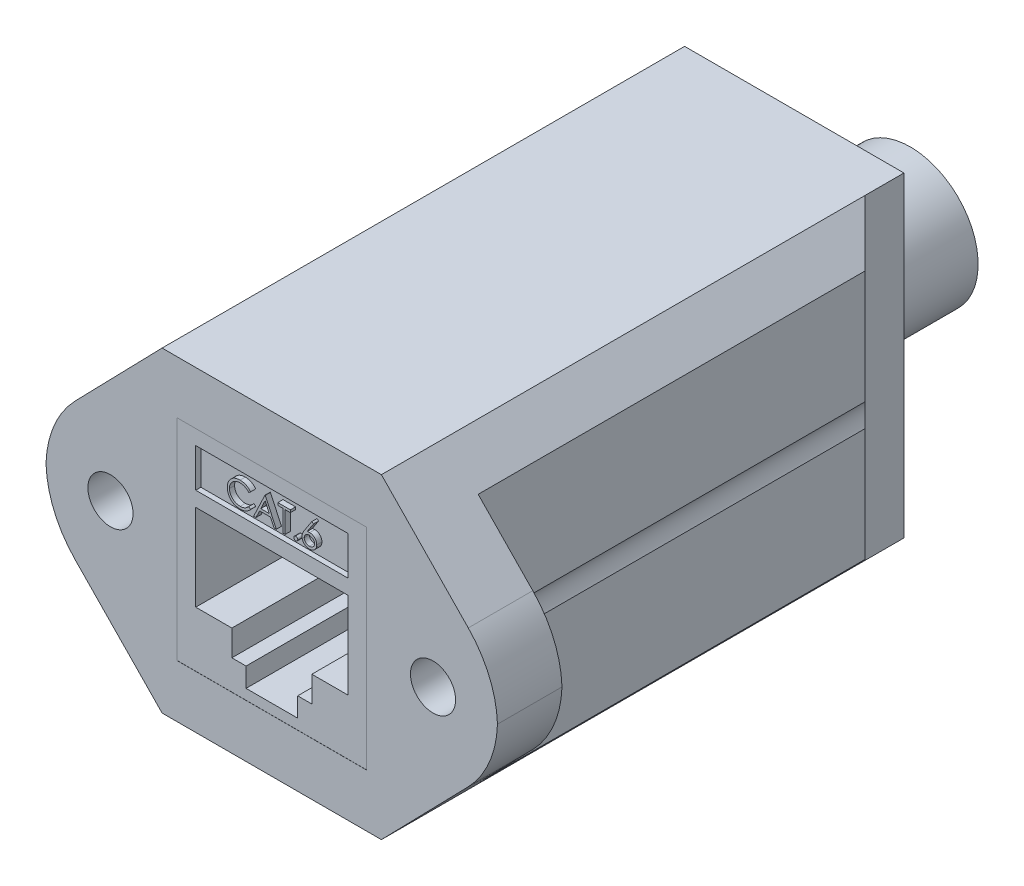
from build123d import *

# Parameters (mm, degrees)
BOSS_EXTRUDE1_DEPTH = 5
FILLET1_R           = 8
BOSS_EXTRUDE2_DEPTH = 30
SKETCH5_W           = 17
SKETCH5_H           = 24.5
BOSS_EXTRUDE3_DEPTH = 5.5
CHAMFER2_SIZE       = 2.5
SKETCH6_R           = 5.25
BOSS_EXTRUDE4_DEPTH = 9
SKETCH7_W           = 14.7
SKETCH7_H           = 16.3
CUT_EXTRUDE1_DEPTH  = 0.01
SKETCH10_R          = 1.75
CUT_EXTRUDE2_DEPTH  = 66.385221365
CUT_EXTRUDE3_DEPTH  = 11
SKETCH12_W          = 11.8
SKETCH12_H          = 3
CUT_EXTRUDE4_DEPTH  = 0.4
BOSS_EXTRUDE5_DEPTH = 0.4


with BuildPart() as part:
    # Sketch2 → Boss-Extrude1 (new body)
    with BuildSketch(Plane.XY):
        Polygon((9, 0), (0, 9.25), (0, 15.25), (9, 24.5), (26, 24.5), (35, 15.25), (35, 9.25), (26, 0), align=None)
    extrude(amount=BOSS_EXTRUDE1_DEPTH)

    # Fillet1
    # the kernel refuses this fillet: 8 mm, written as the material it takes off along each edge
    with BuildSketch(Plane(origin=(35, 9.25, -8.124243331), x_dir=(0, 1, 0), z_dir=(0, 0, 1)), Plane(origin=(35, 15.25, -8.124243331), x_dir=(-0.6973549598034526, 0.7167259309091062, 0), z_dir=(0, 0, 1)), Plane(origin=(0, 9.25, -8.124243331), x_dir=(0.6973549598034534, -0.7167259309091056, 0), z_dir=(0, 0, 1)), Plane(origin=(0, 15.25, -8.124243331), x_dir=(0, -1, 0), z_dir=(0, 0, 1))) as fillet1_piece_1:
        with BuildLine():
            CenterArc((FILLET1_R * 0.406212166571, FILLET1_R), FILLET1_R, 225.784824603, 44.215175397)
            Line((-FILLET1_R * 0.291142793232, FILLET1_R * 0.283274069091), (0, 0))
            Line((0, 0), (FILLET1_R * 0.406212166571, 0))
        make_face()
    extrude(amount=21.248486663, mode=Mode.SUBTRACT)

    # Sketch4 → Boss-Extrude2 (add)
    with BuildSketch(Plane(origin=(0, 0, 0), x_dir=(-1, 0, 0), z_dir=(0, 0, -1))):
        Polygon((-28.5, 21.930555556), (-28.5, 2.569444444), (-26, 0), (-9, 0), (-6.5, 2.569444444), (-6.5, 21.930555556), (-9, 24.5), (-26, 24.5), align=None)
    extrude(amount=BOSS_EXTRUDE2_DEPTH)

    # Sketch5 → Boss-Extrude3 (add)
    with BuildSketch(Plane(origin=(0, 0, -30), x_dir=(-1, 0, 0), z_dir=(0, 0, -1))):
        with Locations((-17.5, 12.25)):
            Rectangle(SKETCH5_W, SKETCH5_H)
    extrude(amount=BOSS_EXTRUDE3_DEPTH)

    # Chamfer2
    # the kernel refuses this chamfer: 2.5 mm, written as the material it adds along each edge
    with BuildSketch(Plane(origin=(9, 0, -30), x_dir=(-0.9996219169112968, 0, 0.027495876610586317), z_dir=(0, 1, 0))) as chamfer2_piece_1_section:
        Polygon((CHAMFER2_SIZE * 0.999621916911, -CHAMFER2_SIZE * 0.0274958766106), (-CHAMFER2_SIZE * 0.0274958766106, -CHAMFER2_SIZE * 0.999621916911), (0, 0), align=None)
    chamfer2_piece_1 = extrude(amount=24.5, mode=Mode.PRIVATE)
    chamfer2_piece_1 = split(chamfer2_piece_1, bisect_by=Plane(origin=(2.494903331, 6.685793799, -30.844793424), z_dir=(0.7167259309091052, 0.6973549598034537, 0)), keep=Keep.TOP, mode=Mode.PRIVATE)
    chamfer2_piece_1 = split(chamfer2_piece_1, bisect_by=Plane(origin=(6.5, 12.25, -30.844793424), z_dir=(1, 0, 0)), keep=Keep.TOP, mode=Mode.PRIVATE)
    chamfer2_piece_1 = split(chamfer2_piece_1, bisect_by=Plane(origin=(2.494903331, 17.814206201, -30.844793424), z_dir=(0.7167259309091052, -0.6973549598034539, 0)), keep=Keep.TOP, mode=Mode.PRIVATE)
    add(chamfer2_piece_1)
    with BuildSketch(Plane(origin=(26, 24.5, -30), x_dir=(-0.027495876610586282, 0, -0.9996219169112968), z_dir=(0, -1, 0))) as chamfer2_piece_2_section:
        Polygon((CHAMFER2_SIZE * 0.999621916911, CHAMFER2_SIZE * 0.0274958766106), (-CHAMFER2_SIZE * 0.0274958766106, CHAMFER2_SIZE * 0.999621916911), (0, 0), align=None)
    chamfer2_piece_2 = extrude(amount=24.5, mode=Mode.PRIVATE)
    chamfer2_piece_2 = split(chamfer2_piece_2, bisect_by=Plane(origin=(32.505096669, 6.685793799, -30.844793424), z_dir=(-0.7167259309091054, 0.6973549598034535, 0)), keep=Keep.TOP, mode=Mode.PRIVATE)
    chamfer2_piece_2 = split(chamfer2_piece_2, bisect_by=Plane(origin=(32.505096669, 17.814206201, -30.844793424), z_dir=(-0.7167259309091054, -0.6973549598034536, 0)), keep=Keep.TOP, mode=Mode.PRIVATE)
    chamfer2_piece_2 = split(chamfer2_piece_2, bisect_by=Plane(origin=(28.5, 12.25, -30.844793424), z_dir=(-1, 0, 0)), keep=Keep.TOP, mode=Mode.PRIVATE)
    add(chamfer2_piece_2)

    # Sketch6 → Boss-Extrude4 (add)
    with BuildSketch(Plane(origin=(0, 0, -35.5), x_dir=(-1, 0, 0), z_dir=(0, 0, -1))):
        with Locations((-17.5, 12.25)):
            Circle(SKETCH6_R)
    extrude(amount=BOSS_EXTRUDE4_DEPTH)

    # Sketch7 → Cut-Extrude1 (cut)
    with BuildSketch(Plane.XY.offset(5)):
        with Locations((17.5, 12.25)):
            Rectangle(SKETCH7_W, SKETCH7_H)
    extrude(amount=-CUT_EXTRUDE1_DEPTH, mode=Mode.SUBTRACT)

    # Sketch10 → Cut-Extrude2 (cut, through all)
    with BuildSketch(Plane.XY.offset(5)):
        with Locations((5, 12.25)):
            Circle(SKETCH10_R)
        with Locations((30, 12.25)):
            Circle(SKETCH10_R)
    extrude(amount=-CUT_EXTRUDE2_DEPTH, mode=Mode.SUBTRACT)

    # Sketch11 → Cut-Extrude3 (cut)
    with BuildSketch(Plane.XY.offset(4.99)):
        Polygon((20.6, 8.4), (23.4, 8.4), (23.4, 15.1), (11.6, 15.1), (11.6, 8.4), (14.4, 8.4), (14.4, 6.4), (15.5, 6.4), (15.5, 4.9), (19.5, 4.9), (19.5, 6.4), (20.6, 6.4), align=None)
    extrude(amount=-CUT_EXTRUDE3_DEPTH, mode=Mode.SUBTRACT)

    # Sketch12 → Cut-Extrude4 (cut)
    with BuildSketch(Plane.XY.offset(4.99)):
        with Locations((17.5, 17.75)):
            Rectangle(SKETCH12_W, SKETCH12_H)
    extrude(amount=-CUT_EXTRUDE4_DEPTH, mode=Mode.SUBTRACT)

    # Sketch13 → Boss-Extrude5 (add)
    # profile 1 of 5: a face of its own
    with BuildSketch(Plane.XY.offset(4.59)):
        with BuildLine():
            Line((15.849746261, 18.262237914), (15.70431023, 18.150934829))
            add(Edge.make_bspline(
                [(15.70431023, 18.150934829), (15.693935447, 18.163299321), (15.673325757, 18.187861606), (15.640168595, 18.222352448), (15.605613142, 18.254666149), (15.569672607, 18.284956644), (15.531700073, 18.312164682), (15.492615401, 18.337708141), (15.451764769, 18.360603986), (15.395275309, 18.388365649), (15.321378323, 18.417335489), (15.228353554, 18.441625949), (15.131245597, 18.457088821), (15.064995201, 18.45876355), (15.031297576, 18.459615385)],
                knots=[0, 0, 0, 0, 0.757959112, 1.505699292, 2.245454638, 2.979532153, 3.711538275, 4.438200793, 5.171680507, 5.909471876, 7.393775596, 8.890124382, 10.418191784, 12, 12, 12, 12], degree=3))
            add(Edge.make_bspline(
                [(15.031297576, 18.459615385), (15.012732664, 18.459401621), (14.975775138, 18.458976078), (14.920927821, 18.453362083), (14.867104665, 18.445471567), (14.814340681, 18.433763584), (14.762703032, 18.418961406), (14.711854136, 18.401273791), (14.662530193, 18.379390189), (14.614048876, 18.355202901), (14.567599043, 18.327883378), (14.52364908, 18.298084229), (14.482359281, 18.266138916), (14.443696982, 18.231927705), (14.407622659, 18.195604668), (14.374397707, 18.156782704), (14.344137094, 18.115585929), (14.316241002, 18.072557584), (14.291257597, 18.027823003), (14.270339702, 17.981216611), (14.251816159, 17.933536523), (14.237158643, 17.884244034), (14.225556919, 17.833685987), (14.217551864, 17.781726695), (14.212001715, 17.728474706), (14.211578288, 17.692380612), (14.21136485, 17.674186615)],
                knots=[0, 0, 0, 0, 1.054917814, 2.100044995, 3.131103042, 4.146048494, 5.169673617, 6.183595914, 7.203665975, 8.234915748, 9.262203917, 10.264457458, 11.251630812, 12.227803204, 13.197192746, 14.159520551, 15.12972552, 16.100847026, 17.073214652, 18.039054194, 19.002613845, 19.979014051, 20.95965708, 21.949030935, 22.966165397, 24, 24, 24, 24], degree=3))
            add(Edge.make_bspline(
                [(14.21136485, 17.674186615), (14.212032563, 17.646812125), (14.213343528, 17.593065945), (14.225010772, 17.514341497), (14.242740549, 17.438924307), (14.269312958, 17.367285807), (14.302078456, 17.298542634), (14.34348078, 17.233857908), (14.391432031, 17.172254142), (14.446610578, 17.115187249), (14.507150322, 17.063057069), (14.572104425, 17.017151553), (14.641311111, 16.978884928), (14.714006244, 16.947041823), (14.790749229, 16.922564305), (14.871402062, 16.905332456), (14.955789327, 16.894091802), (15.013452301, 16.893015642), (15.042798895, 16.892467949)],
                knots=[0, 0, 0, 0, 1.029171465, 2.020641659, 2.987623507, 3.938342917, 4.889210282, 5.84687017, 6.821220943, 7.821438502, 8.827599549, 9.822697543, 10.807740252, 11.797342354, 12.80366471, 13.83203677, 14.896651826, 16, 16, 16, 16], degree=3))
            add(Edge.make_bspline(
                [(15.042798895, 16.892467949), (15.075132401, 16.893361595), (15.138772476, 16.895120504), (15.232100557, 16.91002144), (15.321442816, 16.934182088), (15.40680406, 16.967994738), (15.487943644, 17.01195012), (15.564988543, 17.06523608), (15.638003791, 17.128359489), (15.681909428, 17.176557645), (15.70431023, 17.201148504)],
                knots=[0, 0, 0, 0, 1.028121516, 2.023589091, 2.998037872, 3.967518031, 4.937445131, 5.927275754, 6.942489185, 8, 8, 8, 8], degree=3))
            Line((15.70431023, 17.201148504), (15.849746261, 17.09095845))
            add(Edge.make_bspline(
                [(15.849746261, 17.09095845), (15.838042094, 17.075856853), (15.814689824, 17.045725994), (15.776876623, 17.00324888), (15.737042386, 16.963294662), (15.69489124, 16.926185462), (15.650908075, 16.891178724), (15.604303143, 16.859269005), (15.555689113, 16.830010912), (15.505230702, 16.803220831), (15.452981519, 16.779452121), (15.399004172, 16.759103669), (15.343531326, 16.741575082), (15.286560445, 16.727154265), (15.227973357, 16.715898317), (15.167981481, 16.708373739), (15.106455338, 16.703218642), (15.064946753, 16.702748787), (15.043911926, 16.702510684)],
                knots=[0, 0, 0, 0, 0.986787822, 1.968848986, 2.935600012, 3.899624008, 4.868462664, 5.837806735, 6.815139263, 7.798259679, 8.787526145, 9.778297419, 10.776456485, 11.791383307, 12.812564526, 13.85620153, 14.913611965, 16, 16, 16, 16], degree=3))
            add(Edge.make_bspline(
                [(15.043911926, 16.702510684), (15.023992152, 16.702649321), (14.984603266, 16.70292346), (14.92644851, 16.707364316), (14.86983319, 16.713423135), (14.814919117, 16.722546037), (14.761406622, 16.733311584), (14.709780813, 16.747742624), (14.659533681, 16.763908225), (14.6108671, 16.782907947), (14.563739676, 16.80434776), (14.518303409, 16.828579127), (14.474579197, 16.85539828), (14.432137162, 16.884214056), (14.391604274, 16.915952045), (14.352629283, 16.950171473), (14.314993639, 16.986757003), (14.291708885, 17.01313853), (14.280001753, 17.026402661)],
                knots=[0, 0, 0, 0, 1.114604814, 2.203992996, 3.262667896, 4.300477797, 5.318619304, 6.316056647, 7.298880507, 8.271930387, 9.238335007, 10.195173496, 11.151986948, 12.108099108, 13.064862484, 14.031167946, 15.010108607, 16, 16, 16, 16], degree=3))
            add(Edge.make_bspline(
                [(14.280001753, 17.026402661), (14.261250391, 17.049443207), (14.223974052, 17.095246133), (14.176282544, 17.169480798), (14.135458629, 17.246986892), (14.102451371, 17.328171604), (14.076647758, 17.412852763), (14.058771876, 17.501073056), (14.047155819, 17.592750092), (14.045827458, 17.655105393), (14.045152244, 17.686800965)],
                knots=[0, 0, 0, 0, 0.994628077, 1.977248131, 2.950237994, 3.925870899, 4.908910175, 5.911660606, 6.938484602, 8, 8, 8, 8], degree=3))
            add(Edge.make_bspline(
                [(14.045152244, 17.686800965), (14.0459752, 17.720114892), (14.047594316, 17.785657965), (14.061350424, 17.881846682), (14.083479537, 17.974001797), (14.114910391, 18.061951279), (14.154759473, 18.146157719), (14.203986056, 18.225977856), (14.262018252, 18.301922163), (14.328400923, 18.372838302), (14.401196971, 18.437682043), (14.479153177, 18.494729492), (14.562116957, 18.542205011), (14.64917432, 18.58189048), (14.74097716, 18.612394009), (14.83732961, 18.63374757), (14.938050619, 18.647038711), (15.006769486, 18.648718925), (15.041685864, 18.64957265)],
                knots=[0, 0, 0, 0, 1.032925535, 2.032216505, 3.007276963, 3.968222605, 4.92396291, 5.891752235, 6.871517503, 7.883894988, 8.900124299, 9.891468569, 10.874487609, 11.85992873, 12.854644235, 13.869047385, 14.917252991, 16, 16, 16, 16], degree=3))
            add(Edge.make_bspline(
                [(15.041685864, 18.64957265), (15.062966022, 18.649317518), (15.105087952, 18.648812511), (15.167398731, 18.643888011), (15.228063629, 18.635678728), (15.28712444, 18.624504807), (15.344868491, 18.610636766), (15.400854452, 18.592570859), (15.45541084, 18.571914027), (15.508193579, 18.548123506), (15.55894942, 18.521418188), (15.607662555, 18.492094088), (15.653946043, 18.460187557), (15.698125559, 18.42596996), (15.739462054, 18.388717389), (15.77912917, 18.349454495), (15.815779823, 18.307050346), (15.838403389, 18.277202735), (15.849746261, 18.262237914)],
                knots=[0, 0, 0, 0, 1.096760587, 2.17092713, 3.219439832, 4.250915756, 5.268269357, 6.278326846, 7.281116186, 8.274029601, 9.260640565, 10.235837813, 11.203064059, 12.156899882, 13.114053108, 14.069676657, 15.032185724, 16, 16, 16, 16], degree=3))
        make_face()
    # profile 2 of 5: a face of its own
    with BuildSketch(Plane.XY.offset(4.59)):
        Polygon((16.98948985, 18.602083333), (17.844297543, 16.75), (17.663615535, 16.75), (17.389809946, 17.343616453), (16.550213675, 17.343616453), (16.26861687, 16.75), (16.087192842, 16.75), (16.965745192, 18.602083333), align=None)
        Polygon((16.97576247, 18.241090328), (16.640369174, 17.533573718), (17.302251519, 17.533573718), align=None, mode=Mode.SUBTRACT)
    # profile 3 of 5: a face of its own
    with BuildSketch(Plane.XY.offset(4.59)):
        Polygon((17.963020833, 18.412126068), (17.963020833, 18.602083333), (18.936551816, 18.602083333), (18.936551816, 18.412126068), (18.532892628, 18.412126068), (18.532892628, 16.75), (18.366680021, 16.75), (18.366680021, 18.412126068), align=None)
    # profile 4 of 5: a face of its own
    with BuildSketch(Plane.XY.offset(4.59)):
        with BuildLine():
            add(Edge.make_bspline(
                [(19.352083333, 17.034935897), (19.362396904, 17.034323034), (19.382615453, 17.033121588), (19.411846159, 17.024878931), (19.438301666, 17.01024289), (19.461866646, 16.990736336), (19.48129049, 16.967084881), (19.496448126, 16.94084038), (19.504618981, 16.911364953), (19.505811676, 16.89102925), (19.506423611, 16.88059562)],
                knots=[0, 0, 0, 0, 1.020151414, 1.999887582, 2.974338812, 3.990962822, 5.007586832, 5.987933904, 6.967670073, 8, 8, 8, 8], degree=3))
            add(Edge.make_bspline(
                [(19.506423611, 16.88059562), (19.505790939, 16.870412691), (19.504543319, 16.850332105), (19.496466856, 16.821078998), (19.481174971, 16.794818094), (19.46200062, 16.770845713), (19.438295841, 16.751297835), (19.411783614, 16.736786316), (19.382684073, 16.727953476), (19.362408352, 16.726828311), (19.352083333, 16.726255342)],
                knots=[0, 0, 0, 0, 1.009421747, 1.99056486, 2.972319754, 3.999869655, 5.017953583, 5.993804169, 6.978383603, 8, 8, 8, 8], degree=3))
            add(Edge.make_bspline(
                [(19.352083333, 16.726255342), (19.341750875, 16.726807579), (19.32157921, 16.72788569), (19.292588288, 16.736967675), (19.2659146, 16.751161756), (19.242214436, 16.770882162), (19.222879495, 16.794694738), (19.208261063, 16.821259855), (19.199482109, 16.850248366), (19.198327535, 16.870396198), (19.197743056, 16.88059562)],
                knots=[0, 0, 0, 0, 1.022052826, 1.995314843, 2.982371812, 4.00089066, 5.028879526, 6.005146991, 6.990147033, 8, 8, 8, 8], degree=3))
            add(Edge.make_bspline(
                [(19.197743056, 16.88059562), (19.198305083, 16.891046333), (19.199402373, 16.911450068), (19.208279493, 16.940659596), (19.222766072, 16.967207062), (19.242348093, 16.990700252), (19.265908867, 17.010378533), (19.292523942, 17.02470032), (19.321649032, 17.033188371), (19.341762624, 17.034343286), (19.352083333, 17.034935897)],
                knots=[0, 0, 0, 0, 1.032775665, 2.016367738, 2.991239715, 4.008302682, 5.025365648, 6.011011707, 6.979408107, 8, 8, 8, 8], degree=3))
        make_face()
    # profile 5 of 5: a face of its own
    with BuildSketch(Plane.XY.offset(4.59)):
        with BuildLine():
            Line((20.598677885, 18.64957265), (20.726676432, 18.549028863))
            Line((20.726676432, 18.549028863), (20.237313869, 17.800701122))
            add(Edge.make_bspline(
                [(20.237313869, 17.800701122), (20.269894807, 17.80589429), (20.333447611, 17.816024151), (20.397776232, 17.81769523), (20.429126185, 17.818509615)],
                knots=[0, 0, 0, 0, 1.025318673, 2, 2, 2, 2], degree=3))
            add(Edge.make_bspline(
                [(20.429126185, 17.818509615), (20.447949965, 17.818003673), (20.485004014, 17.81700774), (20.539405947, 17.809343369), (20.591681759, 17.797265081), (20.641614779, 17.779658512), (20.689384231, 17.757167683), (20.735264249, 17.730212531), (20.778392396, 17.697401192), (20.819324062, 17.660748486), (20.856485901, 17.620152415), (20.889387397, 17.577077541), (20.917024074, 17.531568741), (20.939446941, 17.483649066), (20.956859106, 17.433392383), (20.969552568, 17.380862993), (20.977055936, 17.326024672), (20.978074842, 17.288729971), (20.978592415, 17.269785407)],
                knots=[0, 0, 0, 0, 1.04369286, 2.054478336, 3.041073146, 4.015093852, 4.984733326, 5.965804835, 6.960378782, 7.985147595, 9.009457201, 10.008161701, 10.986880575, 11.956520048, 12.937015923, 13.931873656, 14.949455224, 16, 16, 16, 16], degree=3))
            add(Edge.make_bspline(
                [(20.978592415, 17.269785407), (20.977839355, 17.24386698), (20.976357512, 17.19286565), (20.961591753, 17.118582976), (20.938647274, 17.047816187), (20.905850832, 16.981695134), (20.865114321, 16.920310441), (20.815437428, 16.865919798), (20.758581916, 16.81741107), (20.694295152, 16.776846943), (20.625110333, 16.743719495), (20.552428235, 16.719925388), (20.476954703, 16.705276218), (20.425728931, 16.703439691), (20.399816373, 16.702510684)],
                knots=[0, 0, 0, 0, 1.031375318, 2.029502543, 3.004789286, 3.987476834, 4.960371455, 5.9300674, 6.912260825, 7.929083631, 8.949397511, 9.960523116, 10.96833055, 12, 12, 12, 12], degree=3))
            add(Edge.make_bspline(
                [(20.399816373, 16.702510684), (20.374894369, 16.703319359), (20.325528242, 16.704921204), (20.252909222, 16.719190679), (20.183131709, 16.742319021), (20.116684578, 16.77418241), (20.055131587, 16.814429707), (20.000063521, 16.862881413), (19.951754957, 16.918501838), (19.91155172, 16.981282355), (19.879664808, 17.048745791), (19.855751806, 17.119091703), (19.841783793, 17.192063777), (19.839831932, 17.241530879), (19.838848825, 17.266446314)],
                knots=[0, 0, 0, 0, 1.012016664, 2.004627821, 2.994792927, 3.992885782, 4.990978636, 5.973936114, 6.964471063, 7.975201453, 8.993600317, 9.990122807, 10.98767138, 12, 12, 12, 12], degree=3))
            add(Edge.make_bspline(
                [(19.838848825, 17.266446314), (19.839474006, 17.285519906), (19.840750507, 17.324464536), (19.849663468, 17.383447585), (19.863985255, 17.443799615), (19.880024427, 17.494998709), (19.896971312, 17.536941265), (19.911074948, 17.570756862), (19.928629521, 17.60555543), (19.947347935, 17.642530229), (19.968915111, 17.680728354), (19.992365476, 17.720788212), (20.018347374, 17.762072699), (20.036561377, 17.790089002), (20.045872563, 17.804411225)],
                knots=[0, 0, 0, 0, 1.173818275, 2.396712641, 3.66331629, 4.989737886, 5.693666774, 6.447286557, 7.243889047, 8.091586357, 8.998013824, 9.943181721, 10.948533338, 12, 12, 12, 12], degree=3))
            Line((20.045872563, 17.804411225), (20.598677885, 18.64957265))
        make_face()
        with BuildLine():
            add(Edge.make_bspline(
                [(20.394251219, 17.62855235), (20.380142447, 17.628140636), (20.352583919, 17.627336437), (20.312151662, 17.622666408), (20.273885899, 17.613872152), (20.237279666, 17.602671635), (20.20301734, 17.587271266), (20.170849912, 17.568564272), (20.140652989, 17.546539732), (20.11274286, 17.521509667), (20.087438288, 17.494105166), (20.065646606, 17.464752544), (20.046849336, 17.434159195), (20.03156604, 17.4020695), (20.019665042, 17.368495728), (20.011056426, 17.333592291), (20.006265482, 17.297125138), (20.005468435, 17.272395855), (20.005061432, 17.259768129)],
                knots=[0, 0, 0, 0, 1.129588631, 2.206414736, 3.251139165, 4.268635594, 5.265702196, 6.250456724, 7.242448911, 8.251968645, 9.246821453, 10.222880186, 11.173611482, 12.116736599, 13.062300278, 14.020270554, 14.989073742, 16, 16, 16, 16], degree=3))
            add(Edge.make_bspline(
                [(20.005061432, 17.259768129), (20.005392881, 17.247253348), (20.006042805, 17.222713725), (20.011944241, 17.18655091), (20.020958638, 17.151750312), (20.034367931, 17.118491341), (20.050362993, 17.08626704), (20.07147956, 17.056244618), (20.094877609, 17.026600664), (20.122846149, 16.999612385), (20.152862262, 16.974499922), (20.184930398, 16.952549954), (20.218352544, 16.933771854), (20.253579921, 16.919055148), (20.290112733, 16.906977297), (20.328255359, 16.898478097), (20.368034329, 16.893672985), (20.394980521, 16.8928749), (20.40872062, 16.892467949)],
                knots=[0, 0, 0, 0, 0.989467248, 1.94019797, 2.891935182, 3.827694429, 4.772920941, 5.730924762, 6.725747692, 7.756678648, 8.79901574, 9.819492441, 10.826891316, 11.826466727, 12.835195252, 13.867842842, 14.912794438, 16, 16, 16, 16], degree=3))
            add(Edge.make_bspline(
                [(20.40872062, 16.892467949), (20.422460696, 16.892874932), (20.449406844, 16.89367308), (20.489186133, 16.898477738), (20.527327577, 16.906978614), (20.563864688, 16.919050372), (20.599076195, 16.933789574), (20.63246911, 16.952433131), (20.664233976, 16.97463491), (20.694269794, 16.99956947), (20.722121919, 17.026754271), (20.746081146, 17.055979999), (20.766551024, 17.086509685), (20.783184948, 17.118364402), (20.796446548, 17.151770422), (20.805506657, 17.186545522), (20.811395906, 17.222715136), (20.812047504, 17.247253824), (20.812379808, 17.259768129)],
                knots=[0, 0, 0, 0, 1.087397944, 2.132534446, 3.165364764, 4.174271784, 5.174024072, 6.181601208, 7.194203697, 8.236725232, 9.267838612, 10.269026844, 11.221737037, 12.171628256, 13.107553087, 14.05945871, 15.010357665, 16, 16, 16, 16], degree=3))
            add(Edge.make_bspline(
                [(20.812379808, 17.259768129), (20.812088611, 17.272412329), (20.811517087, 17.297228781), (20.805052814, 17.333575979), (20.796087474, 17.368673067), (20.782549787, 17.402299465), (20.764962116, 17.434322477), (20.743539646, 17.464903866), (20.718757411, 17.494278091), (20.690130796, 17.521563411), (20.658968047, 17.546512073), (20.625833967, 17.568535755), (20.591169331, 17.587122721), (20.555009286, 17.602631063), (20.516939511, 17.61382266), (20.477574623, 17.622635001), (20.436411149, 17.627324485), (20.408483527, 17.628137849), (20.394251219, 17.62855235)],
                knots=[0, 0, 0, 0, 0.978206639, 1.919901502, 2.851605144, 3.780102724, 4.718870031, 5.675451981, 6.667674623, 7.690630536, 8.733308323, 9.756129687, 10.767539656, 11.776269907, 12.797430371, 13.836405707, 14.897401972, 16, 16, 16, 16], degree=3))
        make_face(mode=Mode.SUBTRACT)
    extrude(amount=BOSS_EXTRUDE5_DEPTH)


solid = part.part
